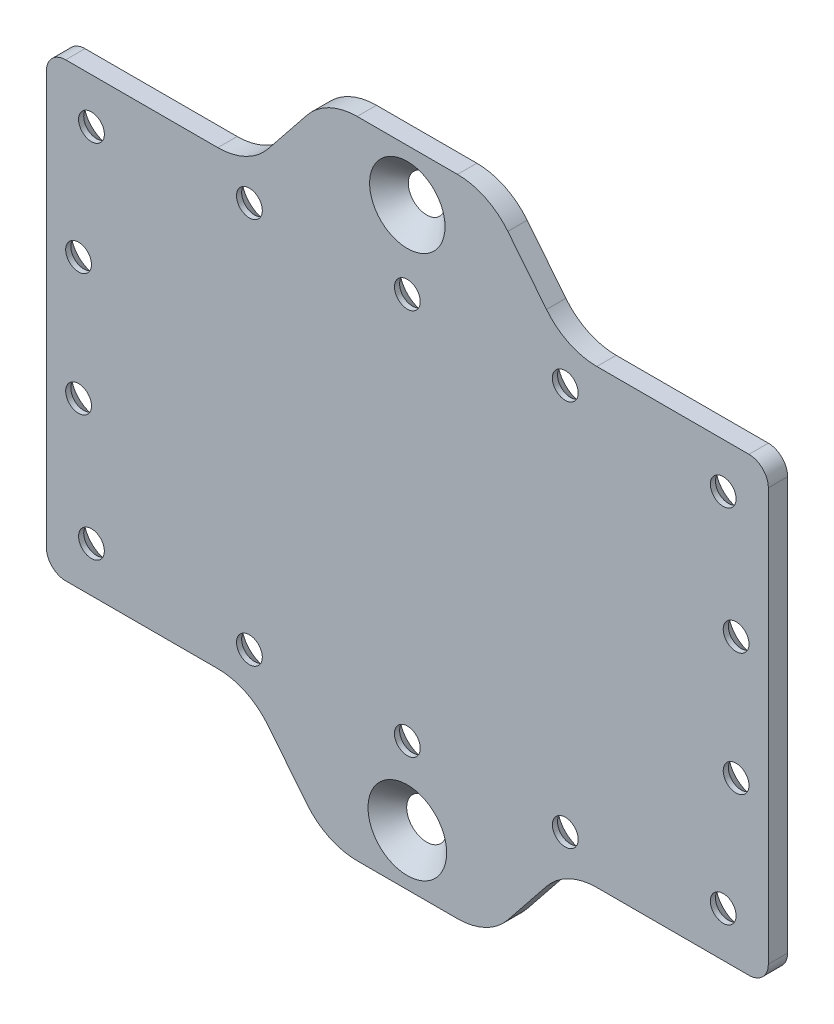
from build123d import *

# Parameters (mm, degrees)
BOSS_EXTRUDE1_DEPTH = 3
CUT_EXTRUDE1_START  = -10
SKETCH3_R           = 3
CUT_EXTRUDE1_DEPTH  = 10
FILLET1_R           = 10
FILLET2_R           = 3
SKETCH6_R           = 2.749742151
CUT_EXTRUDE4_DEPTH  = 10
CHAMFER3_SIZE       = 3.1
CUT_EXTRUDE5_REACH  = 88.822
SKETCH7_R           = 1.6
SKETCH8_R           = 2
CUT_EXTRUDE6_DEPTH  = 87.822446845
CHAMFER4_SIZE       = 2.2


with BuildPart() as part:
    # Sketch1 → Boss-Extrude1 (new body)
    with BuildSketch(Plane.XY):
        with BuildLine():
            Line((-42.619167718, 55.881324086), (63.380832282, 55.881324086))
            ThreePointArc((63.380832282, 55.881324086), (65.502152626, 55.002644429), (66.380832282, 52.881324086))
            Line((66.380832282, 52.881324086), (66.380832282, -41.118675914))
            ThreePointArc((66.380832282, -41.118675914), (65.502152626, -43.239996258), (63.380832282, -44.118675914))
            Line((63.380832282, -44.118675914), (-42.619167718, -44.118675914))
            ThreePointArc((-42.619167718, -44.118675914), (-44.740488061, -43.239996258), (-45.619167718, -41.118675914))
            Line((-45.619167718, -41.118675914), (-45.619167718, 52.881324086))
            ThreePointArc((-45.619167718, 52.881324086), (-44.740488061, 55.002644429), (-42.619167718, 55.881324086))
        make_face()
    extrude(amount=BOSS_EXTRUDE1_DEPTH)

    # Sketch3 → Cut-Extrude1 (cut)
    with BuildSketch(Plane.XY.offset(3).offset(CUT_EXTRUDE1_START)):
        with BuildLine():
            Line((-42.619167718, 55.881324086), (-2.210402905, 55.881324086))
            Line((-2.210402905, 55.881324086), (-2.210402905, 63.915751743))
            Line((-2.210402905, 63.915751743), (-45.619167718, 63.915751743))
            Line((-45.619167718, 63.915751743), (-45.619167718, 52.881324086))
            ThreePointArc((-45.619167718, 52.881324086), (-44.740488061, 55.002644429), (-42.619167718, 55.881324086))
        make_face()
        with BuildLine():
            Line((-11.208282286, 44.63427273), (-2.210402905, 55.881324086))
            Line((-2.210402905, 55.881324086), (-42.619167718, 55.881324086))
            ThreePointArc((-42.619167718, 55.881324086), (-44.740488061, 55.002644429), (-45.619167718, 52.881324086))
            Line((-45.619167718, 52.881324086), (-45.619167718, 40.881324086))
            Line((-45.619167718, 40.881324086), (-19.016889675, 40.881324086))
            ThreePointArc((-19.016889675, 40.881324086), (-14.68506059, 41.868263741), (-11.208282286, 44.63427273))
        make_face()
        with BuildLine():
            Line((22.972067469, 63.915751743), (22.972067469, 55.881324086))
            Line((22.972067469, 55.881324086), (63.380832282, 55.881324086))
            ThreePointArc((63.380832282, 55.881324086), (65.502152626, 55.002644429), (66.380832282, 52.881324086))
            Line((66.380832282, 52.881324086), (66.380832282, 63.915751743))
            Line((66.380832282, 63.915751743), (22.972067469, 63.915751743))
        make_face()
        with BuildLine():
            Line((63.380832282, 55.881324086), (22.972067469, 55.881324086))
            Line((22.972067469, 55.881324086), (31.969946851, 44.63427273))
            ThreePointArc((31.969946851, 44.63427273), (35.446725155, 41.868263741), (39.77855424, 40.881324086))
            Line((39.77855424, 40.881324086), (66.380832282, 40.881324086))
            Line((66.380832282, 40.881324086), (66.380832282, 52.881324086))
            ThreePointArc((66.380832282, 52.881324086), (65.502152626, 55.002644429), (63.380832282, 55.881324086))
        make_face()
        with BuildLine():
            Line((66.380832282, -41.118675914), (66.380832282, -29.118675914))
            Line((66.380832282, -29.118675914), (39.77855424, -29.118675914))
            ThreePointArc((39.77855424, -29.118675914), (35.446725155, -30.105615569), (31.969946851, -32.871624558))
            Line((31.969946851, -32.871624558), (22.972067469, -44.118675914))
            Line((22.972067469, -44.118675914), (63.380832282, -44.118675914))
            ThreePointArc((63.380832282, -44.118675914), (65.502152626, -43.239996258), (66.380832282, -41.118675914))
        make_face()
        with BuildLine():
            Line((66.380832282, -52.153103571), (66.380832282, -41.118675914))
            ThreePointArc((66.380832282, -41.118675914), (65.502152626, -43.239996258), (63.380832282, -44.118675914))
            Line((63.380832282, -44.118675914), (22.972067469, -44.118675914))
            Line((22.972067469, -44.118675914), (22.972067469, -52.153103571))
            Line((22.972067469, -52.153103571), (66.380832282, -52.153103571))
        make_face()
        with BuildLine():
            Line((-19.016889675, -29.118675914), (-45.619167718, -29.118675914))
            Line((-45.619167718, -29.118675914), (-45.619167718, -41.118675914))
            ThreePointArc((-45.619167718, -41.118675914), (-44.740488061, -43.239996258), (-42.619167718, -44.118675914))
            Line((-42.619167718, -44.118675914), (-2.210402905, -44.118675914))
            Line((-2.210402905, -44.118675914), (-11.208282286, -32.871624558))
            ThreePointArc((-11.208282286, -32.871624558), (-14.68506059, -30.105615569), (-19.016889675, -29.118675914))
        make_face()
        with BuildLine():
            ThreePointArc((-42.619167718, -44.118675914), (-44.740488061, -43.239996258), (-45.619167718, -41.118675914))
            Line((-45.619167718, -41.118675914), (-45.619167718, -52.153103571))
            Line((-45.619167718, -52.153103571), (-2.210402905, -52.153103571))
            Line((-2.210402905, -52.153103571), (-2.210402905, -44.118675914))
            Line((-2.210402905, -44.118675914), (-42.619167718, -44.118675914))
        make_face()
        with Locations((10.380832282, -36.118675914)):
            Circle(SKETCH3_R)
    extrude(amount=CUT_EXTRUDE1_DEPTH, mode=Mode.SUBTRACT)

    # Fillet1
    fillet1_edges = [part.edges().sort_by_distance(p)[0] for p in [
        (-2.210402905, 55.881324086, 1.5),
        (22.972067469, 55.881324086, 1.5),
        (22.972067469, -44.118675914, 1.5),
        (-2.210402905, -44.118675914, 1.5),
    ]]
    fillet(fillet1_edges, radius=FILLET1_R)

    # Fillet2
    fillet2_edges = [part.edges().sort_by_distance(p)[0] for p in [
        (-45.619167718, -29.118675914, 1.5),
        (-45.619167718, 40.881324086, 1.5),
        (66.380832282, 40.881324086, 1.5),
        (66.380832282, -29.118675914, 1.5),
    ]]
    fillet(fillet2_edges, radius=FILLET2_R)

    # Sketch6 → Cut-Extrude4 (cut)
    with BuildSketch(Plane.XY.offset(3)):
        with Locations((10.380832282, 47.881324086)):
            Circle(SKETCH6_R)
    extrude(amount=-CUT_EXTRUDE4_DEPTH, mode=Mode.SUBTRACT)

    # Chamfer3
    # the kernel refuses this chamfer: 3.1 mm, written as the material it takes off along each edge
    with BuildSketch(Plane(origin=(10.380832282, -36.118675914, 3), x_dir=(1, 0, 0), z_dir=(0, -1, 0))) as chamfer3_piece_1:
        Polygon((3, -CHAMFER3_SIZE), (3 + CHAMFER3_SIZE, 0), (3, 0), align=None)
    revolve(axis=Axis((10.380832282, -36.118675914, 3), (0, 0, 1)), mode=Mode.SUBTRACT)
    with BuildSketch(Plane(origin=(10.380832282, 47.881324086, 3), x_dir=(1, 0, 0), z_dir=(0, -1, 0))) as chamfer3_piece_2:
        Polygon((2.749742151, -CHAMFER3_SIZE), (2.749742151 + CHAMFER3_SIZE, 0), (2.749742151, 0), align=None)
    revolve(axis=Axis((10.380832282, 47.881324086, 3), (0, 0, 1)), mode=Mode.SUBTRACT)

    # Sketch7 → Cut-Extrude5 (cut, up to next)
    with BuildSketch(Plane(origin=(0, 0, 0), x_dir=(-1, 0, 0), z_dir=(0, 0, -1)), mode=Mode.PRIVATE) as cut_extrude5_sk1:
        with Locations((38.619167718, -22.118675914)):
            Circle(SKETCH7_R)
    cut_extrude5_tool1 = extrude(cut_extrude5_sk1.sketch, amount=-CUT_EXTRUDE5_REACH, mode=Mode.PRIVATE) & part.part
    # Sketch7 → Cut-Extrude5 (cut, up to next)
    with BuildSketch(Plane(origin=(0, 0, 0), x_dir=(-1, 0, 0), z_dir=(0, 0, -1)), mode=Mode.PRIVATE) as cut_extrude5_sk2:
        with Locations((14.119167718, -24.118675914)):
            Circle(SKETCH7_R)
    cut_extrude5_tool2 = extrude(cut_extrude5_sk2.sketch, amount=-CUT_EXTRUDE5_REACH, mode=Mode.PRIVATE) & part.part
    # Sketch7 → Cut-Extrude5 (cut, up to next)
    with BuildSketch(Plane(origin=(0, 0, 0), x_dir=(-1, 0, 0), z_dir=(0, 0, -1)), mode=Mode.PRIVATE) as cut_extrude5_sk3:
        with Locations((-10.380832282, -24.118675914)):
            Circle(SKETCH7_R)
    cut_extrude5_tool3 = extrude(cut_extrude5_sk3.sketch, amount=-CUT_EXTRUDE5_REACH, mode=Mode.PRIVATE) & part.part
    # Sketch7 → Cut-Extrude5 (cut, up to next)
    with BuildSketch(Plane(origin=(0, 0, 0), x_dir=(-1, 0, 0), z_dir=(0, 0, -1)), mode=Mode.PRIVATE) as cut_extrude5_sk4:
        with Locations((-34.880832282, -24.118675914)):
            Circle(SKETCH7_R)
    cut_extrude5_tool4 = extrude(cut_extrude5_sk4.sketch, amount=-CUT_EXTRUDE5_REACH, mode=Mode.PRIVATE) & part.part
    # Sketch7 → Cut-Extrude5 (cut, up to next)
    with BuildSketch(Plane(origin=(0, 0, 0), x_dir=(-1, 0, 0), z_dir=(0, 0, -1)), mode=Mode.PRIVATE) as cut_extrude5_sk5:
        with Locations((-59.380832282, -22.118675914)):
            Circle(SKETCH7_R)
    cut_extrude5_tool5 = extrude(cut_extrude5_sk5.sketch, amount=-CUT_EXTRUDE5_REACH, mode=Mode.PRIVATE) & part.part
    # Sketch7 → Cut-Extrude5 (cut, up to next)
    with BuildSketch(Plane(origin=(0, 0, 0), x_dir=(-1, 0, 0), z_dir=(0, 0, -1)), mode=Mode.PRIVATE) as cut_extrude5_sk6:
        with Locations((-61.380832282, -3.618675914)):
            Circle(SKETCH7_R)
    cut_extrude5_tool6 = extrude(cut_extrude5_sk6.sketch, amount=-CUT_EXTRUDE5_REACH, mode=Mode.PRIVATE) & part.part
    # Sketch7 → Cut-Extrude5 (cut, up to next)
    with BuildSketch(Plane(origin=(0, 0, 0), x_dir=(-1, 0, 0), z_dir=(0, 0, -1)), mode=Mode.PRIVATE) as cut_extrude5_sk7:
        with Locations((-61.380832282, 15.381324086)):
            Circle(SKETCH7_R)
    cut_extrude5_tool7 = extrude(cut_extrude5_sk7.sketch, amount=-CUT_EXTRUDE5_REACH, mode=Mode.PRIVATE) & part.part
    # Sketch7 → Cut-Extrude5 (cut, up to next)
    with BuildSketch(Plane(origin=(0, 0, 0), x_dir=(-1, 0, 0), z_dir=(0, 0, -1)), mode=Mode.PRIVATE) as cut_extrude5_sk8:
        with Locations((-59.380832282, 33.881324086)):
            Circle(SKETCH7_R)
    cut_extrude5_tool8 = extrude(cut_extrude5_sk8.sketch, amount=-CUT_EXTRUDE5_REACH, mode=Mode.PRIVATE) & part.part
    # Sketch7 → Cut-Extrude5 (cut, up to next)
    with BuildSketch(Plane(origin=(0, 0, 0), x_dir=(-1, 0, 0), z_dir=(0, 0, -1)), mode=Mode.PRIVATE) as cut_extrude5_sk9:
        with Locations((-34.880832282, 35.881324086)):
            Circle(SKETCH7_R)
    cut_extrude5_tool9 = extrude(cut_extrude5_sk9.sketch, amount=-CUT_EXTRUDE5_REACH, mode=Mode.PRIVATE) & part.part
    # Sketch7 → Cut-Extrude5 (cut, up to next)
    with BuildSketch(Plane(origin=(0, 0, 0), x_dir=(-1, 0, 0), z_dir=(0, 0, -1)), mode=Mode.PRIVATE) as cut_extrude5_sk10:
        with Locations((-10.380832282, 35.881324086)):
            Circle(SKETCH7_R)
    cut_extrude5_tool10 = extrude(cut_extrude5_sk10.sketch, amount=-CUT_EXTRUDE5_REACH, mode=Mode.PRIVATE) & part.part
    # Sketch7 → Cut-Extrude5 (cut, up to next)
    with BuildSketch(Plane(origin=(0, 0, 0), x_dir=(-1, 0, 0), z_dir=(0, 0, -1)), mode=Mode.PRIVATE) as cut_extrude5_sk11:
        with Locations((14.119167718, 35.881324086)):
            Circle(SKETCH7_R)
    cut_extrude5_tool11 = extrude(cut_extrude5_sk11.sketch, amount=-CUT_EXTRUDE5_REACH, mode=Mode.PRIVATE) & part.part
    # Sketch7 → Cut-Extrude5 (cut, up to next)
    with BuildSketch(Plane(origin=(0, 0, 0), x_dir=(-1, 0, 0), z_dir=(0, 0, -1)), mode=Mode.PRIVATE) as cut_extrude5_sk12:
        with Locations((38.619167718, 33.881324086)):
            Circle(SKETCH7_R)
    cut_extrude5_tool12 = extrude(cut_extrude5_sk12.sketch, amount=-CUT_EXTRUDE5_REACH, mode=Mode.PRIVATE) & part.part
    # Sketch7 → Cut-Extrude5 (cut, up to next)
    with BuildSketch(Plane(origin=(0, 0, 0), x_dir=(-1, 0, 0), z_dir=(0, 0, -1)), mode=Mode.PRIVATE) as cut_extrude5_sk13:
        with Locations((40.619167718, 15.381324086)):
            Circle(SKETCH7_R)
    cut_extrude5_tool13 = extrude(cut_extrude5_sk13.sketch, amount=-CUT_EXTRUDE5_REACH, mode=Mode.PRIVATE) & part.part
    # Sketch7 → Cut-Extrude5 (cut, up to next)
    with BuildSketch(Plane(origin=(0, 0, 0), x_dir=(-1, 0, 0), z_dir=(0, 0, -1)), mode=Mode.PRIVATE) as cut_extrude5_sk14:
        with Locations((40.619167718, -3.618675914)):
            Circle(SKETCH7_R)
    cut_extrude5_tool14 = extrude(cut_extrude5_sk14.sketch, amount=-CUT_EXTRUDE5_REACH, mode=Mode.PRIVATE) & part.part
    add(cut_extrude5_tool1.solids().sort_by_distance((-38.619168, -22.118676, 0))[0], mode=Mode.SUBTRACT)
    add(cut_extrude5_tool2.solids().sort_by_distance((-14.119168, -24.118676, 0))[0], mode=Mode.SUBTRACT)
    add(cut_extrude5_tool3.solids().sort_by_distance((10.380832, -24.118676, 0))[0], mode=Mode.SUBTRACT)
    add(cut_extrude5_tool4.solids().sort_by_distance((34.880832, -24.118676, 0))[0], mode=Mode.SUBTRACT)
    add(cut_extrude5_tool5.solids().sort_by_distance((59.380832, -22.118676, 0))[0], mode=Mode.SUBTRACT)
    add(cut_extrude5_tool6.solids().sort_by_distance((61.380832, -3.618676, 0))[0], mode=Mode.SUBTRACT)
    add(cut_extrude5_tool7.solids().sort_by_distance((61.380832, 15.381324, 0))[0], mode=Mode.SUBTRACT)
    add(cut_extrude5_tool8.solids().sort_by_distance((59.380832, 33.881324, 0))[0], mode=Mode.SUBTRACT)
    add(cut_extrude5_tool9.solids().sort_by_distance((34.880832, 35.881324, 0))[0], mode=Mode.SUBTRACT)
    add(cut_extrude5_tool10.solids().sort_by_distance((10.380832, 35.881324, 0))[0], mode=Mode.SUBTRACT)
    add(cut_extrude5_tool11.solids().sort_by_distance((-14.119168, 35.881324, 0))[0], mode=Mode.SUBTRACT)
    add(cut_extrude5_tool12.solids().sort_by_distance((-38.619168, 33.881324, 0))[0], mode=Mode.SUBTRACT)
    add(cut_extrude5_tool13.solids().sort_by_distance((-40.619168, 15.381324, 0))[0], mode=Mode.SUBTRACT)
    add(cut_extrude5_tool14.solids().sort_by_distance((-40.619168, -3.618676, 0))[0], mode=Mode.SUBTRACT)

    # Sketch8 → Cut-Extrude6 (cut, through all)
    with BuildSketch(Plane(origin=(0, 0, 0), x_dir=(-1, 0, 0), z_dir=(0, 0, -1))):
        with Locations((-59.380832282, 33.881324086)):
            Circle(SKETCH8_R)
        with Locations((-34.880832282, 35.881324086)):
            Circle(SKETCH8_R)
        with Locations((-10.380832282, 35.881324086)):
            Circle(SKETCH8_R)
        with Locations((14.119167718, 35.881324086)):
            Circle(SKETCH8_R)
        with Locations((38.619167718, 33.881324086)):
            Circle(SKETCH8_R)
        with Locations((40.619167718, 15.381324086)):
            Circle(SKETCH8_R)
        with Locations((38.619167718, -22.118675914)):
            Circle(SKETCH8_R)
        with Locations((40.619167718, -3.618675914)):
            Circle(SKETCH8_R)
        with Locations((14.119167718, -24.118675914)):
            Circle(SKETCH8_R)
        with Locations((-10.380832282, -24.118675914)):
            Circle(SKETCH8_R)
        with Locations((-34.880832282, -24.118675914)):
            Circle(SKETCH8_R)
        with Locations((-59.380832282, -22.118675914)):
            Circle(SKETCH8_R)
        with Locations((-61.380832282, -3.618675914)):
            Circle(SKETCH8_R)
        with Locations((-61.380832282, 15.381324086)):
            Circle(SKETCH8_R)
    extrude(amount=-CUT_EXTRUDE6_DEPTH, mode=Mode.SUBTRACT)

    # Chamfer4
    chamfer4_edges = [part.edges().sort_by_distance(p)[0] for p in [
        (61.380832282, 33.881324086, 0),
        (63.380832282, 15.381324086, 0),
        (63.380832282, -3.618675914, 0),
        (61.380832282, -22.118675914, 0),
        (36.880832282, -24.118675914, 0),
        (12.380832282, -24.118675914, 0),
        (-12.119167718, -24.118675914, 0),
        (-38.619167718, -3.618675914, 0),
        (-36.619167718, -22.118675914, 0),
        (-38.619167718, 15.381324086, 0),
        (-36.619167718, 33.881324086, 0),
        (-12.119167718, 35.881324086, 0),
        (12.380832282, 35.881324086, 0),
        (36.880832282, 35.881324086, 0),
    ]]
    chamfer(chamfer4_edges, length=CHAMFER4_SIZE)


solid = part.part
